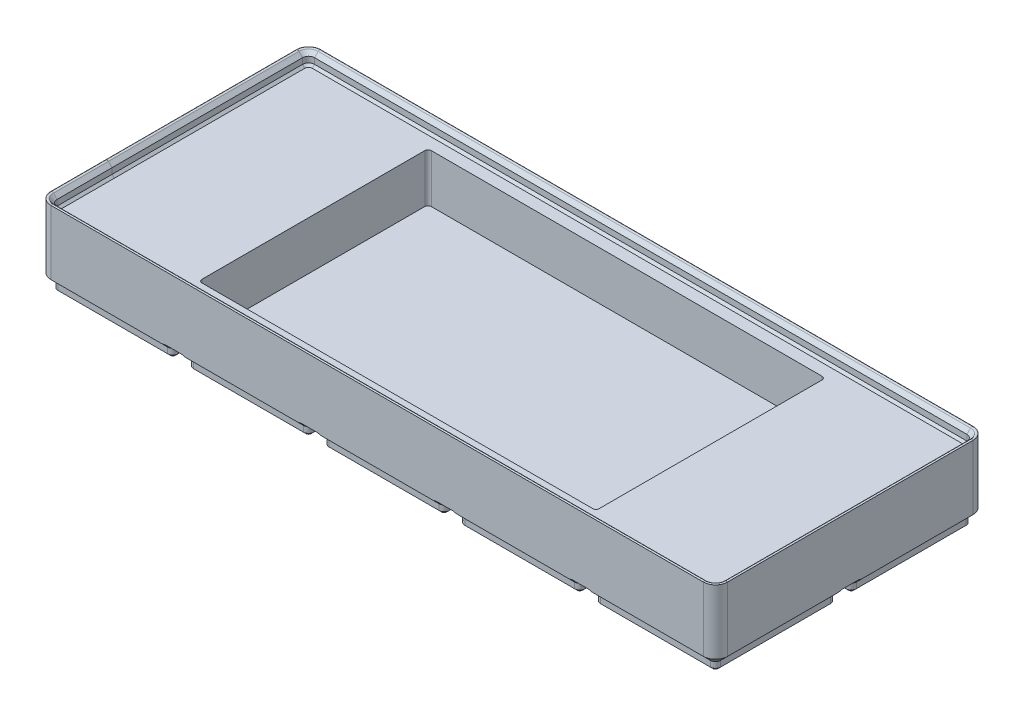
from build123d import *

# Parameters (mm, degrees)
BASE_DEPTH                          = 5
BOX_START                           = -84
BOX_OUTLINE_W                       = 210
BOX_OUTLINE_H                       = 16
BOX_DEPTH                           = 84
CORNER_FILLET_R                     = 4
BASE_CHAMFER_1_SIZE                 = 2.4
BASE_CHAMFER_2_SIZE                 = 0.8
BASE_PATTERN_COUNT                  = 2
BASE_PATTERN_PITCH                  = 42
BASE_PATTERN_COUNT_DIR2             = 5
BASE_PATTERN_PITCH_DIR2             = 42
BASE_CHAMFER_1_OF_BASE_PATTERN_SIZE = 2.4
BASE_CHAMFER_2_OF_BASE_PATTERN_SIZE = 0.8
INTERIOR_CUT_DEPTH                  = 13.8
TOP_EDGE_FILLET_R                   = 0.6
NESTING_CLEARANCE_CUT_DEPTH         = 228.532276445
BOSS_EXTRUDE1_START                 = 13.8
BOSS_EXTRUDE1_DEPTH                 = 13.8
CUT_EXTRUDE1_DEPTH                  = 227.826200115
CUT_EXTRUDE1_DEPTH_BACK             = 15


# Read off the part's stored shape, not the designer's step: Box
with BuildPart() as part:
    # Master → Base (new body)
    with BuildSketch(Plane(origin=(0, 0, 0), x_dir=(1, 0, 0), z_dir=(0, 1, 0))):
        with BuildLine():
            Line((4, 2.4), (38, 2.4))
            ThreePointArc((38, 2.4), (39.13137085, 2.86862915), (39.6, 4))
            Line((39.6, 4), (39.6, 38))
            ThreePointArc((39.6, 38), (39.13137085, 39.13137085), (38, 39.6))
            Line((38, 39.6), (4, 39.6))
            ThreePointArc((4, 39.6), (2.86862915, 39.13137085), (2.4, 38))
            Line((2.4, 38), (2.4, 4))
            ThreePointArc((2.4, 4), (2.86862915, 2.86862915), (4, 2.4))
        make_face()
    base = extrude(amount=-BASE_DEPTH)

    # Box outline → Box (add)
    with BuildSketch(Plane.XY.offset(BOX_START)):
        with Locations((105, 8)):
            Rectangle(BOX_OUTLINE_W, BOX_OUTLINE_H)
    extrude(amount=BOX_DEPTH)

    # Corner Fillet
    corner_fillet_edges = [part.edges().sort_by_distance(p)[0] for p in [
        (0, 8, 0),
        (210, 8, 0),
        (210, 8, -84),
        (0, 8, -84),
    ]]
    fillet(corner_fillet_edges, radius=CORNER_FILLET_R)

    # Base Chamfer 1
    base_chamfer_1_edges = [part.edges().sort_by_distance(p)[0] for p in [
        (21, 0, -39.6),
        (2.86862915, 0, -39.13137085),
        (2.4, 0, -21),
        (2.86862915, 0, -2.86862915),
        (21, 0, -2.4),
        (39.13137085, 0, -2.86862915),
        (39.6, 0, -21),
        (39.13137085, 0, -39.13137085),
    ]]
    chamfer(base_chamfer_1_edges, length=BASE_CHAMFER_1_SIZE - 0.0001)  # a hair under: the kernel refuses the full size

    # Base Chamfer 2
    base_chamfer_2_edges = [part.edges().sort_by_distance(p)[0] for p in [
        (2.86862915, -5, -39.13137085),
        (21, -5, -39.6),
        (39.13137085, -5, -39.13137085),
        (39.6, -5, -21),
        (39.13137085, -5, -2.86862915),
        (21, -5, -2.4),
        (2.86862915, -5, -2.86862915),
        (2.4, -5, -21),
    ]]
    chamfer(base_chamfer_2_edges, length=BASE_CHAMFER_2_SIZE)

    # Base Pattern: Base 2 × 5
    with Locations(*[(j * BASE_PATTERN_PITCH_DIR2, 0, -i * BASE_PATTERN_PITCH) for i in range(BASE_PATTERN_COUNT) for j in range(BASE_PATTERN_COUNT_DIR2) if (i, j) != (0, 0)]):
        add(base)

    # Base Chamfer 1 of Base Pattern
    base_chamfer_1_of_base_pattern_edges = [part.edges().sort_by_distance(p)[0] for p in [
        (63, 0, -39.6),
        (44.86862915, 0, -39.13137085),
        (44.4, 0, -21),
        (44.86862915, 0, -2.86862915),
        (63, 0, -2.4),
        (81.13137085, 0, -2.86862915),
        (81.6, 0, -21),
        (81.13137085, 0, -39.13137085),
        (105, 0, -39.6),
        (86.86862915, 0, -39.13137085),
        (86.4, 0, -21),
        (86.86862915, 0, -2.86862915),
        (105, 0, -2.4),
        (123.13137085, 0, -2.86862915),
        (123.6, 0, -21),
        (123.13137085, 0, -39.13137085),
        (147, 0, -39.6),
        (128.86862915, 0, -39.13137085),
        (128.4, 0, -21),
        (128.86862915, 0, -2.86862915),
        (147, 0, -2.4),
        (165.13137085, 0, -2.86862915),
        (165.6, 0, -21),
        (165.13137085, 0, -39.13137085),
        (189, 0, -39.6),
        (170.86862915, 0, -39.13137085),
        (170.4, 0, -21),
        (170.86862915, 0, -2.86862915),
        (189, 0, -2.4),
        (207.13137085, 0, -2.86862915),
        (207.6, 0, -21),
        (207.13137085, 0, -39.13137085),
        (21, 0, -81.6),
        (2.86862915, 0, -81.13137085),
        (2.4, 0, -63),
        (2.86862915, 0, -44.86862915),
        (21, 0, -44.4),
        (39.13137085, 0, -44.86862915),
        (39.6, 0, -63),
        (39.13137085, 0, -81.13137085),
        (63, 0, -81.6),
        (44.86862915, 0, -81.13137085),
        (44.4, 0, -63),
        (44.86862915, 0, -44.86862915),
        (63, 0, -44.4),
        (81.13137085, 0, -44.86862915),
        (81.6, 0, -63),
        (81.13137085, 0, -81.13137085),
        (105, 0, -81.6),
        (86.86862915, 0, -81.13137085),
        (86.4, 0, -63),
        (86.86862915, 0, -44.86862915),
        (105, 0, -44.4),
        (123.13137085, 0, -44.86862915),
        (123.6, 0, -63),
        (123.13137085, 0, -81.13137085),
        (147, 0, -81.6),
        (128.86862915, 0, -81.13137085),
        (128.4, 0, -63),
        (128.86862915, 0, -44.86862915),
        (147, 0, -44.4),
        (165.13137085, 0, -44.86862915),
        (165.6, 0, -63),
        (165.13137085, 0, -81.13137085),
        (189, 0, -81.6),
        (170.86862915, 0, -81.13137085),
        (170.4, 0, -63),
        (170.86862915, 0, -44.86862915),
        (189, 0, -44.4),
        (207.13137085, 0, -44.86862915),
        (207.6, 0, -63),
        (207.13137085, 0, -81.13137085),
    ]]
    chamfer(base_chamfer_1_of_base_pattern_edges, length=BASE_CHAMFER_1_OF_BASE_PATTERN_SIZE - 0.0001)  # a hair under: the kernel refuses the full size

    # Base Chamfer 2 of Base Pattern
    base_chamfer_2_of_base_pattern_edges = [part.edges().sort_by_distance(p)[0] for p in [
        (44.86862915, -5, -39.13137085),
        (63, -5, -39.6),
        (81.13137085, -5, -39.13137085),
        (81.6, -5, -21),
        (81.13137085, -5, -2.86862915),
        (63, -5, -2.4),
        (44.86862915, -5, -2.86862915),
        (44.4, -5, -21),
        (86.86862915, -5, -39.13137085),
        (105, -5, -39.6),
        (123.13137085, -5, -39.13137085),
        (123.6, -5, -21),
        (123.13137085, -5, -2.86862915),
        (105, -5, -2.4),
        (86.86862915, -5, -2.86862915),
        (86.4, -5, -21),
        (128.86862915, -5, -39.13137085),
        (147, -5, -39.6),
        (165.13137085, -5, -39.13137085),
        (165.6, -5, -21),
        (165.13137085, -5, -2.86862915),
        (147, -5, -2.4),
        (128.86862915, -5, -2.86862915),
        (128.4, -5, -21),
        (170.86862915, -5, -39.13137085),
        (189, -5, -39.6),
        (207.13137085, -5, -39.13137085),
        (207.6, -5, -21),
        (207.13137085, -5, -2.86862915),
        (189, -5, -2.4),
        (170.86862915, -5, -2.86862915),
        (170.4, -5, -21),
        (2.86862915, -5, -81.13137085),
        (21, -5, -81.6),
        (39.13137085, -5, -81.13137085),
        (39.6, -5, -63),
        (39.13137085, -5, -44.86862915),
        (21, -5, -44.4),
        (2.86862915, -5, -44.86862915),
        (2.4, -5, -63),
        (44.86862915, -5, -81.13137085),
        (63, -5, -81.6),
        (81.13137085, -5, -81.13137085),
        (81.6, -5, -63),
        (81.13137085, -5, -44.86862915),
        (63, -5, -44.4),
        (44.86862915, -5, -44.86862915),
        (44.4, -5, -63),
        (86.86862915, -5, -81.13137085),
        (105, -5, -81.6),
        (123.13137085, -5, -81.13137085),
        (123.6, -5, -63),
        (123.13137085, -5, -44.86862915),
        (105, -5, -44.4),
        (86.86862915, -5, -44.86862915),
        (86.4, -5, -63),
        (128.86862915, -5, -81.13137085),
        (147, -5, -81.6),
        (165.13137085, -5, -81.13137085),
        (165.6, -5, -63),
        (165.13137085, -5, -44.86862915),
        (147, -5, -44.4),
        (128.86862915, -5, -44.86862915),
        (128.4, -5, -63),
        (170.86862915, -5, -81.13137085),
        (189, -5, -81.6),
        (207.13137085, -5, -81.13137085),
        (207.6, -5, -63),
        (207.13137085, -5, -44.86862915),
        (189, -5, -44.4),
        (170.86862915, -5, -44.86862915),
        (170.4, -5, -63),
    ]]
    chamfer(base_chamfer_2_of_base_pattern_edges, length=BASE_CHAMFER_2_OF_BASE_PATTERN_SIZE)

    # Top Nesting Feature: sweep along a path in Sketch5
    with BuildLine(Plane(origin=(0, 16, 0), x_dir=(1, 0, 0), z_dir=(0, 1, 0))) as top_nesting_feature_path:
        Line((4, 0), (206, 0))
        ThreePointArc((206, 0), (208.828427125, 1.171572875), (210, 4))
        Line((210, 4), (210, 80))
        ThreePointArc((210, 80), (208.828427125, 82.828427125), (206, 84))
        Line((206, 84), (4, 84))
        ThreePointArc((4, 84), (1.171572875, 82.828427125), (0, 80))
        Line((0, 80), (0, 4))
        ThreePointArc((0, 4), (1.171572875, 1.171572875), (4, 0))
    # Sketch4 → Top Nesting Feature (sweep)
    with BuildSketch(Plane(origin=(0, 0, -21), x_dir=(-1, 0, 0), z_dir=(0, 0, -1))):
        Polygon((0, 16), (0, 20.646446609), (-2.15, 18.496446609), (-2.15, 16.696446609), (-2.846446609, 16), align=None)
    sweep(path=top_nesting_feature_path.line)

    # Sketch6 → Interior Cut (cut)
    with BuildSketch(Plane(origin=(0, 16, 0), x_dir=(1, 0, 0), z_dir=(0, 1, 0))):
        with BuildLine():
            Line((2.846446609, 80), (2.846446609, 21))
            Line((2.846446609, 21), (2.846446609, 4))
            ThreePointArc((2.846446609, 4), (3.184314575, 3.184314575), (4, 2.846446609))
            Line((4, 2.846446609), (206, 2.846446609))
            ThreePointArc((206, 2.846446609), (206.815685425, 3.184314575), (207.153553391, 4))
            Line((207.153553391, 4), (207.153553391, 80))
            ThreePointArc((207.153553391, 80), (206.815685425, 80.815685425), (206, 81.153553391))
            Line((206, 81.153553391), (4, 81.153553391))
            ThreePointArc((4, 81.153553391), (3.184314575, 80.815685425), (2.846446609, 80))
        make_face()
    extrude(amount=-INTERIOR_CUT_DEPTH, mode=Mode.SUBTRACT)

    # Top Edge Fillet
    top_edge_fillet_edges = [part.edges().sort_by_distance(p)[0] for p in [
        (0, 20.646446609, -42),
        (1.171572875, 20.646446609, -1.171572875),
        (105, 20.646446609, 0),
        (208.828427125, 20.646446609, -1.171572875),
        (210, 20.646446609, -42),
        (208.828427125, 20.646446609, -82.828427125),
        (105, 20.646446609, -84),
        (1.171572875, 20.646446609, -82.828427125),
        (0, 20.646446609, -42),
    ]]
    fillet(top_edge_fillet_edges, radius=TOP_EDGE_FILLET_R)

    # Sketch14 → Nesting Clearance Cut (cut, through all)
    with BuildSketch(Plane.XZ.offset(5)):
        with BuildLine():
            Line((-1, -4), (-1, -80))
            ThreePointArc((-1, -80), (0.464466094, -83.535533906), (4, -85))
            Line((4, -85), (206, -85))
            ThreePointArc((206, -85), (209.535533906, -83.535533906), (211, -80))
            Line((211, -80), (211, -4))
            ThreePointArc((211, -4), (209.535533906, -0.464466094), (206, 1))
            Line((206, 1), (4, 1))
            ThreePointArc((4, 1), (0.464466094, -0.464466094), (-1, -4))
        make_face()
        with BuildLine():
            Line((0.25, -4), (0.25, -80))
            ThreePointArc((0.25, -80), (1.348349571, -82.651650429), (4, -83.75))
            Line((4, -83.75), (206, -83.75))
            ThreePointArc((206, -83.75), (208.651650429, -82.651650429), (209.75, -80))
            Line((209.75, -80), (209.75, -4))
            ThreePointArc((209.75, -4), (208.651650429, -1.348349571), (206, -0.25))
            Line((206, -0.25), (4, -0.25))
            ThreePointArc((4, -0.25), (1.348349571, -1.348349571), (0.25, -4))
        make_face(mode=Mode.SUBTRACT)
    extrude(amount=-NESTING_CLEARANCE_CUT_DEPTH, mode=Mode.SUBTRACT)

    # Sketch15 → Boss-Extrude1 (add)
    with BuildSketch(Plane(origin=(0, 2.2, 0), x_dir=(1, 0, 0), z_dir=(0, 1, 0)).offset(BOSS_EXTRUDE1_START)):
        with BuildLine():
            Line((2.846446609, 80), (2.846446609, 4))
            ThreePointArc((2.846446609, 4), (3.184314575, 3.184314575), (4, 2.846446609))
            Line((4, 2.846446609), (206, 2.846446609))
            ThreePointArc((206, 2.846446609), (206.815685425, 3.184314575), (207.153553391, 4))
            Line((207.153553391, 4), (207.153553391, 80))
            ThreePointArc((207.153553391, 80), (206.815685425, 80.815685425), (206, 81.153553391))
            Line((206, 81.153553391), (4, 81.153553391))
            ThreePointArc((4, 81.153553391), (3.184314575, 80.815685425), (2.846446609, 80))
        make_face()
    extrude(amount=-BOSS_EXTRUDE1_DEPTH)

    # Sketch16 → Cut-Extrude1 (cut, two sides: drawn at the far end of the back side and taken through both)
    with BuildSketch(Plane(origin=(0, 16, 0), x_dir=(1, 0, 0), z_dir=(0, 1, 0)).offset(-CUT_EXTRUDE1_DEPTH_BACK)):
        with BuildLine():
            Line((44.5, 6.5), (165.5, 6.5))
            ThreePointArc((165.5, 6.5), (166.207106781, 6.792893219), (166.5, 7.5))
            Line((166.5, 7.5), (166.5, 76.5))
            ThreePointArc((166.5, 76.5), (166.207106781, 77.207106781), (165.5, 77.5))
            Line((165.5, 77.5), (44.5, 77.5))
            ThreePointArc((44.5, 77.5), (43.792893219, 77.207106781), (43.5, 76.5))
            Line((43.5, 76.5), (43.5, 7.5))
            ThreePointArc((43.5, 7.5), (43.792893219, 6.792893219), (44.5, 6.5))
        make_face()
    extrude(amount=CUT_EXTRUDE1_DEPTH + CUT_EXTRUDE1_DEPTH_BACK, mode=Mode.SUBTRACT)


solid = part.part
